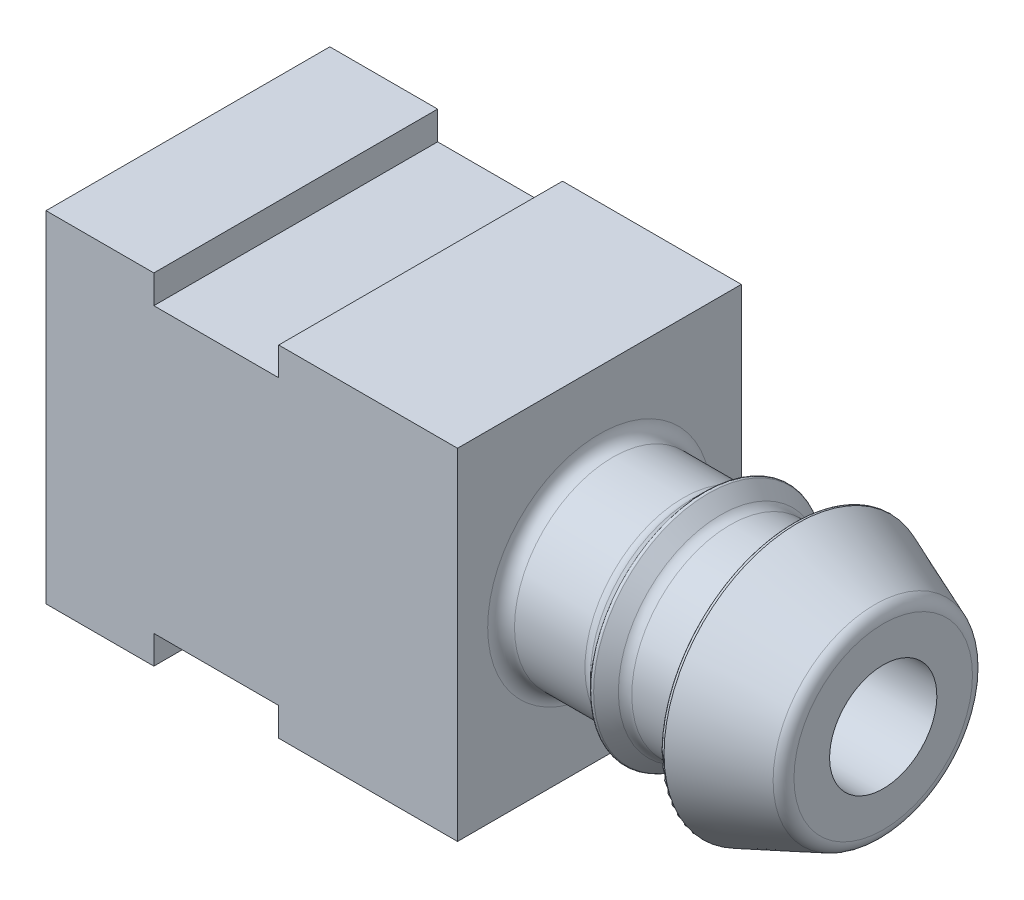
from build123d import *

# Parameters (mm, degrees)
SKETCH2_W                  = 18.415
SKETCH2_H                  = 12.7
SKETCH2_R                  = 3.175
BOSS_EXTRUDE2_DEPTH        = 6.35
F_10_32_TAPPED_HOLE1_D     = 4.0386
F_10_32_TAPPED_HOLE1_DEPTH = 7.112
F_10_32_TAPPED_HOLE1_TIP   = 1.213317848
SKETCH18_R                 = 2.4
CUT_EXTRUDE2_DEPTH         = 20.6
SKETCH12_R                 = 3.175
BOSS_EXTRUDE3_DEPTH        = 12.7
SKETCH13_W                 = 18.415
SKETCH13_H                 = 12.7
BOSS_EXTRUDE4_DEPTH        = 1.27
SKETCH14_W                 = 18.415
SKETCH14_H                 = 12.7
BOSS_EXTRUDE5_DEPTH        = 1.27
SKETCH15_W                 = 5.588
SKETCH15_H                 = 1.27
CUT_EXTRUDE1_DEPTH         = 24.631898464
FILLET1_R                  = 0.1
FILLET2_R                  = 0.6


with BuildPart() as part:
    # Sketch2 → Boss-Extrude2 (new, symmetric)
    with BuildSketch(Plane(origin=(0, 0, 0), x_dir=(1, 0, 0), z_dir=(0, 1, 0))):
        with Locations((-9.2075, 0)):
            Rectangle(SKETCH2_W, SKETCH2_H)
        with Locations((-12.7, 0)):
            Circle(SKETCH2_R, mode=Mode.SUBTRACT)
    extrude(amount=BOSS_EXTRUDE2_DEPTH, both=True)

    # #10-32 Tapped Hole1
    with Locations(Plane(origin=(0, 0, -6.35), x_dir=(-1, 0, 0), z_dir=(0, 0, -1))):
        with Locations((4.8, 0)):
            Hole(F_10_32_TAPPED_HOLE1_D / 2, depth=F_10_32_TAPPED_HOLE1_DEPTH)
            with Locations((0, 0, -(F_10_32_TAPPED_HOLE1_DEPTH + F_10_32_TAPPED_HOLE1_TIP / 2))):  # 118° drill point
                Cone(0, F_10_32_TAPPED_HOLE1_D / 2, F_10_32_TAPPED_HOLE1_TIP, mode=Mode.SUBTRACT)

    # Sketch3 → Revolve1 (revolve)
    with BuildSketch(Plane.XY):
        Polygon((0, 0), (0, 4.4), (4, 4.4), (4.8, 5.2), (5.6, 4.4), (8.7, 4.4), (8.7, 6), (12.7, 4.4), (12.7, 0), align=None)
    revolve(axis=Axis((12.7, 0, 0), (-1, 0, 0)))

    # Sketch18 → Cut-Extrude2 (cut)
    with BuildSketch(Plane(origin=(12.7, 0, 0), x_dir=(0, 0, -1), z_dir=(1, 0, 0))):
        Circle(SKETCH18_R)
    extrude(amount=-CUT_EXTRUDE2_DEPTH, mode=Mode.SUBTRACT)

    # Sketch12 → Boss-Extrude3 (add)
    with BuildSketch(Plane.XZ.offset(6.35)):
        with Locations((-12.7, 0)):
            Circle(SKETCH12_R)
    extrude(amount=-BOSS_EXTRUDE3_DEPTH)

    # Sketch13 → Boss-Extrude4 (add)
    with BuildSketch(Plane.XZ.offset(6.35)):
        with Locations((-9.2075, 0)):
            Rectangle(SKETCH13_W, SKETCH13_H)
    extrude(amount=BOSS_EXTRUDE4_DEPTH)

    # Sketch14 → Boss-Extrude5 (add)
    with BuildSketch(Plane(origin=(0, 6.35, 0), x_dir=(1, 0, 0), z_dir=(0, 1, 0))):
        with Locations((-9.2075, 0)):
            Rectangle(SKETCH14_W, SKETCH14_H)
    extrude(amount=BOSS_EXTRUDE5_DEPTH)

    # Sketch15 → Cut-Extrude1 (cut, through all)
    with BuildSketch(Plane(origin=(0, 0, -6.35), x_dir=(-1, 0, 0), z_dir=(0, 0, -1))):
        with Locations((10.795, 6.985)):
            Rectangle(SKETCH15_W, SKETCH15_H)
        with Locations((10.795, -6.985)):
            Rectangle(SKETCH15_W, SKETCH15_H)
    extrude(amount=-CUT_EXTRUDE1_DEPTH, mode=Mode.SUBTRACT)

    # Fillet1
    fillet1_edges = [part.edges().sort_by_distance(p)[0] for p in [
        (4.8, -5.2, 0),
        (8.7, -6, 0),
    ]]
    fillet(fillet1_edges, radius=FILLET1_R)

    # Fillet2
    fillet2_edges = [part.edges().sort_by_distance(p)[0] for p in [
        (8.7, -4.4, 0),
        (5.6, -4.4, 0),
        (4, -4.4, 0),
        (0, -4.4, 0),
        (12.7, -4.4, 0),
    ]]
    fillet(fillet2_edges, radius=FILLET2_R)


solid = part.part
